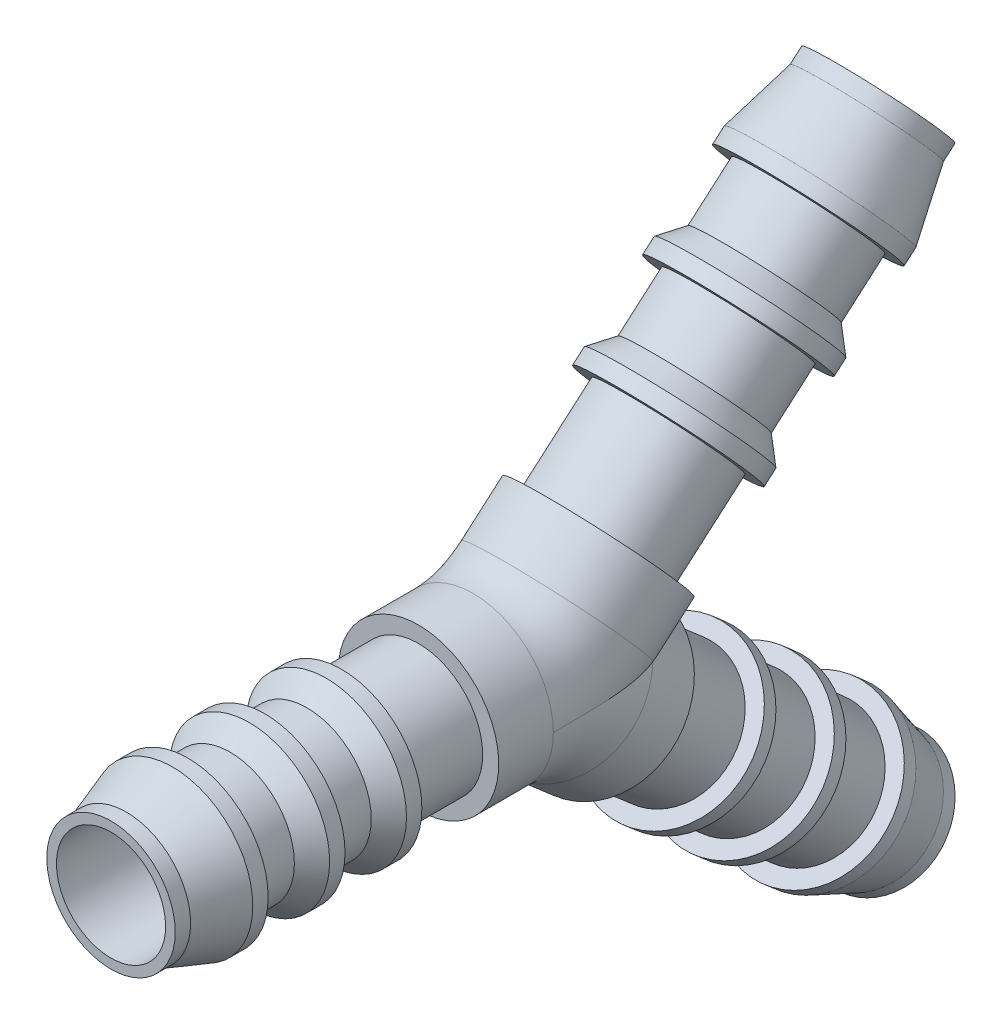
from build123d import *
from build123d.topology import SkipClean

# Parameters (mm, degrees)
SKETCH14_R              = 5.953125
SKETCH14_R_2            = 4.048125
CUT_EXTRUDE1_DEPTH      = 41.798264048
CUT_EXTRUDE1_DEPTH_BACK = 41.798264048
SKETCH15_W              = 50.666666667
SKETCH15_H              = 5.953125
BODY_MOVE_COPY1_ANGLE   = 180


with BuildPart() as part:
    # Sketch11 → Revolve1 (revolve)
    with BuildSketch(Plane(origin=(0, 0, 0), x_dir=(0, 0, -1), z_dir=(1, 0, 0))):
        Polygon((-30.4, 4.048125), (-30.4, 4.7625), (-29.26, 4.7625), (-25.84, 5.953125), (-24.7, 5.953125), (-24.7, 4.7625), (-21.565, 4.7625), (-20.14, 5.953125), (-19, 5.953125), (-19, 4.7625), (-15.865, 4.7625), (-14.44, 5.953125), (-13.3, 5.953125), (-13.3, 4.7625), (-7.6, 4.7625), (-7.6, 4.048125), align=None)
    revolve(axis=Axis((0, 0, 30.4), (0, 0, -1)))



with BuildPart() as body_2:
    # Sketch12 → Revolve2 (revolve)
    with BuildSketch(Plane(origin=(0, 0, 0), x_dir=(0, 0, -1), z_dir=(1, 0, 0))):
        Polygon((23.853077466, 26.00988402), (23.385440142, 26.549927512), (22.523638453, 25.803671625), (18.278426864, 23.702606308), (17.416625175, 22.956350421), (18.196020715, 22.056277933), (14.945655089, 19.2417041), (13.089007437, 19.208956729), (12.227205748, 18.462700842), (13.006601288, 17.562628355), (9.756235662, 14.748054521), (7.899588011, 14.715307151), (7.037786322, 13.969051264), (7.817181861, 13.068978776), (2.627762434, 8.575329197), (3.095399758, 8.035285704), align=None)
    revolve(axis=Axis((0, 0, 0), (0, 0.6546104271218575, -0.7559663938981279)))


with BuildPart() as part_1:
    add(part.part)

    add(body_2.part)  # Sweep7 merges body 2
    # Sweep7: sweep along a path in Sketch13
    with BuildLine(Plane(origin=(0, 0, 0), x_dir=(0, 0, -1), z_dir=(1, 0, 0))) as sweep7_path:
        Line((-7.6, 0), (-3.550844902, 0))
        ThreePointArc((-3.550844902, 0), (-0.223676329, 0.600002841), (2.684319416, 2.324420098))
        Line((2.684319416, 2.324420098), (5.745344594, 4.975039246))
    # Sketch14 → Sweep7 (sweep)
    with BuildSketch(Plane(origin=(0, 4.975039246, -5.745344594), x_dir=(1, 0, 0), z_dir=(0, -0.6546104271218574, 0.7559663938981279))):
        Circle(SKETCH14_R)
        Circle(SKETCH14_R_2, mode=Mode.SUBTRACT)
    sweep(path=sweep7_path.line)

    # Sketch15 → Cut-Extrude1 (cut, two sides: drawn at the far end of the back side and taken through both)
    with SkipClean():  # the faces are left unmerged after this step: merging them gives an invalid solid
        with BuildSketch(Plane(origin=(0, 0, 0), x_dir=(0, 0, -1), z_dir=(1, 0, 0)).offset(-CUT_EXTRUDE1_DEPTH_BACK)):
            with Locations((-5.066666666, -2.9765625)):
                Rectangle(SKETCH15_W, SKETCH15_H)
        extrude(amount=CUT_EXTRUDE1_DEPTH + CUT_EXTRUDE1_DEPTH_BACK, mode=Mode.SUBTRACT)


with BuildPart() as body_2_2:
    # Body-Move/Copy1: copy of part
    add(part_1.part.rotate(Axis((0, 0, 0), (0, 0, 1)), BODY_MOVE_COPY1_ANGLE))


with BuildPart() as part_2:
    add(part_1.part)

    # Combine1: union body 2 2
    add(body_2_2.part)


solid = part_2.part
